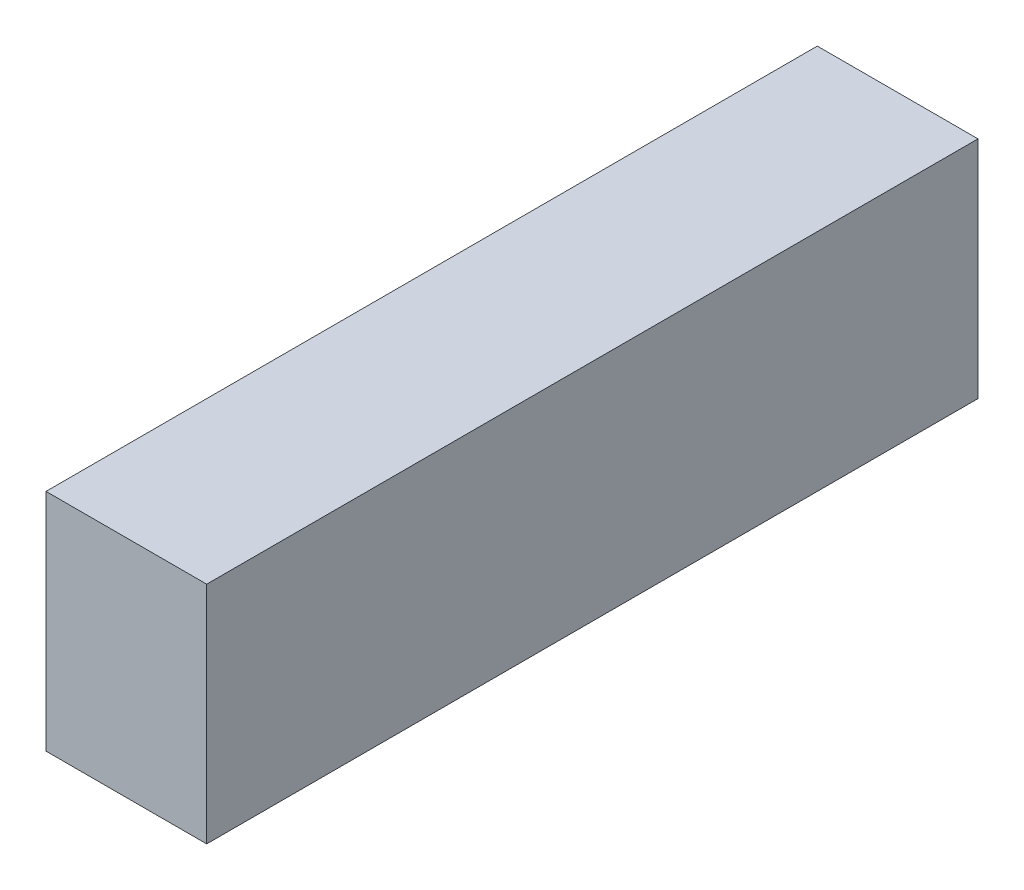
from build123d import *

# Parameters (mm, degrees)
SKETCH1_W           = 120
SKETCH1_H           = 35
BOSS_EXTRUDE1_DEPTH = 25


with BuildPart() as part:
    # Sketch1 → Boss-Extrude1 (new body)
    with BuildSketch(Plane(origin=(0, 0, 0), x_dir=(0, 0, -1), z_dir=(1, 0, 0))):
        Rectangle(SKETCH1_W, SKETCH1_H)
    extrude(amount=BOSS_EXTRUDE1_DEPTH)


solid = part.part
